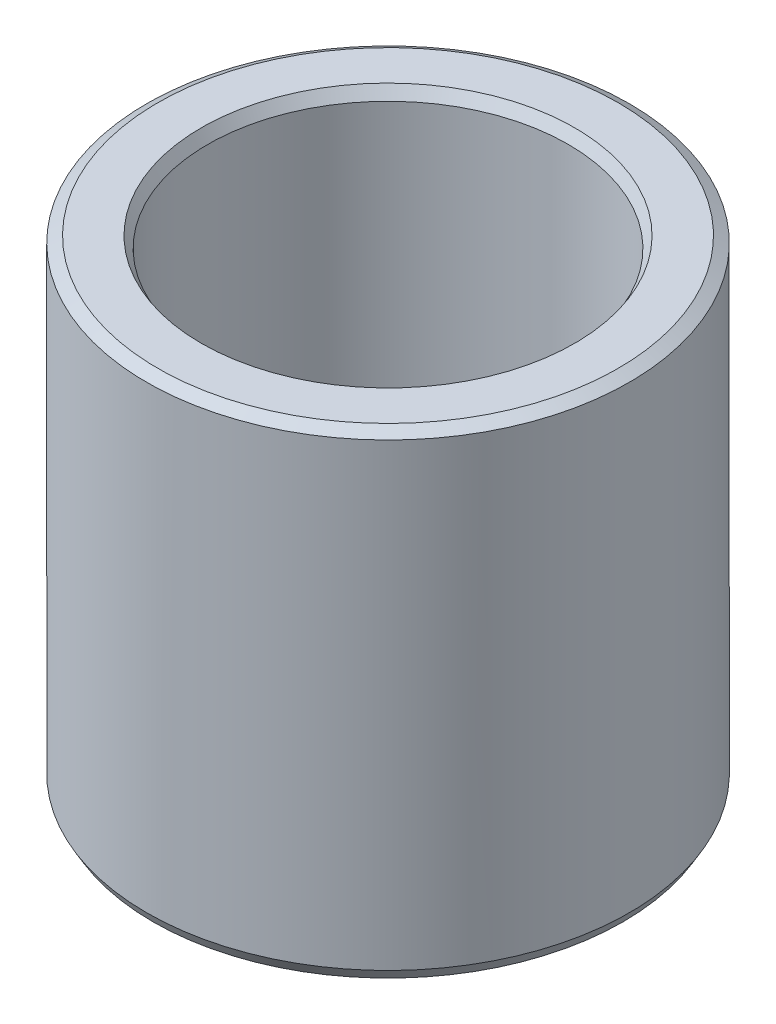
from build123d import *
from OCP.BRepFilletAPI import BRepFilletAPI_MakeChamfer

# Parameters (mm, degrees)
SKETCH1_R           = 57.5
BOSS_EXTRUDE1_DEPTH = 113.649586265
SKETCH2_R           = 42.948320732
CUT_EXTRUDE1_DEPTH  = 140.74522696
CHAMFER1_SIZE       = 1.53738467
CHAMFER1_SIZE2      = 2.662828358


with BuildPart() as part:
    # Sketch1 → Boss-Extrude1 (new body)
    with BuildSketch(Plane(origin=(0, 0, 0), x_dir=(1, 0, 0), z_dir=(0, 1, 0))):
        Circle(SKETCH1_R)
    extrude(amount=BOSS_EXTRUDE1_DEPTH)

    # Sketch2 → Cut-Extrude1 (cut, through all)
    with BuildSketch(Plane(origin=(0, 0, 0), x_dir=(1, 0, 0), z_dir=(0, 1, 0))):
        Circle(SKETCH2_R)
    extrude(amount=CUT_EXTRUDE1_DEPTH, mode=Mode.SUBTRACT)

    # Chamfer1: one chamfer whose edges measure the first distance from different faces: ONE call of the kernel's chamfer builder (chamfer() names one face for all edges)
    chamfer1_edges_1 = [part.edges().sort_by_distance(p)[0] for p in [
        (-42.948320732, 113.649586265, 0),
    ]]
    chamfer1_side_1 = [part.faces().sort_by_distance(p)[0] for p in [
        (-55.873654403, 113.649586265, 0),
    ]]
    chamfer1_edges_2 = [part.edges().sort_by_distance(p)[0] for p in [
        (-42.948320732, 0, 0),
    ]]
    chamfer1_side_2 = [part.faces().sort_by_distance(p)[0] for p in [
        (-42.948320732, 56.824793132, 0),
    ]]
    chamfer1_edges_3 = [part.edges().sort_by_distance(p)[0] for p in [
        (-57.5, 0, 0),
    ]]
    chamfer1_side_3 = [part.faces().sort_by_distance(p)[0] for p in [
        (-55.873654403, 0, 0),
    ]]
    chamfer1_edges_4 = [part.edges().sort_by_distance(p)[0] for p in [
        (-57.5, 113.649586265, 0),
    ]]
    chamfer1_side_4 = [part.faces().sort_by_distance(p)[0] for p in [
        (-57.5, 56.824793132, 0),
    ]]
    chamfer1 = BRepFilletAPI_MakeChamfer(part.part.solid().wrapped)
    for e in chamfer1_edges_1:
        chamfer1.Add(CHAMFER1_SIZE, CHAMFER1_SIZE2, e.wrapped, chamfer1_side_1[0].wrapped)  # the first distance lies on this face
    for e in chamfer1_edges_2:
        chamfer1.Add(CHAMFER1_SIZE, CHAMFER1_SIZE2, e.wrapped, chamfer1_side_2[0].wrapped)  # the first distance lies on this face
    for e in chamfer1_edges_3:
        chamfer1.Add(CHAMFER1_SIZE, CHAMFER1_SIZE2, e.wrapped, chamfer1_side_3[0].wrapped)  # the first distance lies on this face
    for e in chamfer1_edges_4:
        chamfer1.Add(CHAMFER1_SIZE, CHAMFER1_SIZE2, e.wrapped, chamfer1_side_4[0].wrapped)  # the first distance lies on this face
    add(Compound.cast(chamfer1.Shape()), mode=Mode.REPLACE)


solid = part.part
